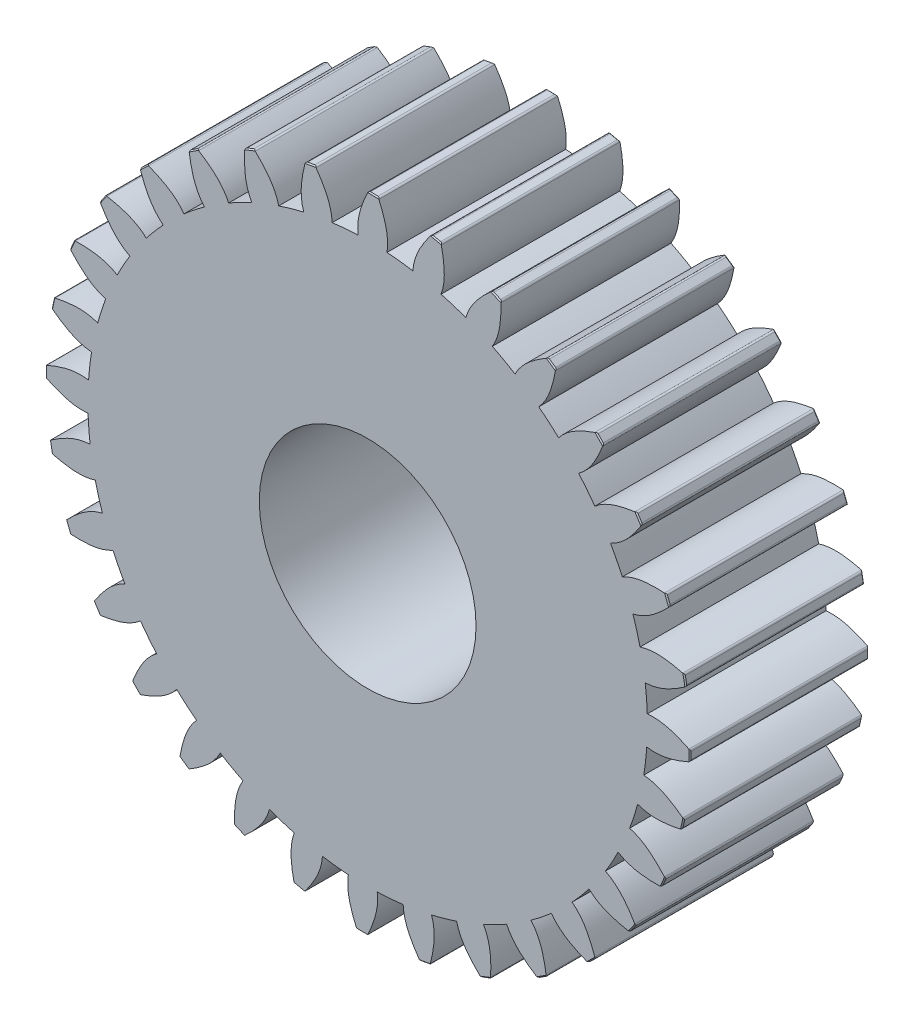
from build123d import *

# Parameters (mm, degrees)
BOSS_EXTRUDE1_DEPTH          = 32.97
CHAMFER1_SIZE                = 0.2
FILLET1_R                    = 0.4
CIRPATTERN1_COUNT            = 32
CHAMFER1_OF_CIRPATTERN1_SIZE = 0.2
FILLET1_OF_CIRPATTERN1_R     = 0.4
SKETCH2_R                    = 20
CUT_EXTRUDE1_DEPTH           = 91.372904183


with BuildPart() as part:
    # Sketch1 → Boss-Extrude1 (new body)
    with BuildSketch(Plane.XY):
        with BuildLine():
            add(Edge.make_bspline(
                [(-12.183256516, 51.965939669), (-12.232441564, 52.341593425), (-12.341968868, 53.847607306), (-12.077216091, 56.010904037), (-11.670723241, 57.750018855), (-11.499653698, 58.378146295)],
                knots=[0, 0, 0, 0, 0.062574462, 0.250076057, 0.35780736, 0.35780736, 0.35780736, 0.35780736], degree=3))
            ThreePointArc((-12.183256516, 51.965939669), (-9.495754582, 52.523530631), (-6.783142181, 52.942228959))
            add(Edge.make_bspline(
                [(-6.783142181, 52.942228959), (-6.868600774, 53.311324803), (-7.293317405, 54.760355453), (-8.298760507, 56.694012855), (-9.288449691, 58.180711245), (-9.668620755, 58.709179629)],
                knots=[0, 0, 0, 0, 0.062574462, 0.250076057, 0.35780736, 0.35780736, 0.35780736, 0.35780736], degree=3))
            ThreePointArc((-9.668620755, 58.709179629), (-10.585431337, 58.550821031), (-11.499653698, 58.378146295))
        make_face()
        with BuildLine():
            ThreePointArc((-6.783142181, 52.942228959), (-9.495754582, 52.523530631), (-12.183256516, 51.965939669))
            add(Edge.make_bspline(
                [(-11.794819767, 50.25955483), (-11.982754877, 50.823685324), (-12.108297794, 51.393437928), (-12.183256516, 51.965939669)],
                knots=[-0.095364383, -0.095364383, -0.095364383, -0.095364383, 0, 0, 0, 0], degree=3))
            ThreePointArc((-11.794819767, 50.25955483), (-9.184418366, 50.801447659), (-6.549522421, 51.207854681))
            add(Edge.make_bspline(
                [(-6.549522421, 51.207854681), (-6.571006643, 51.802077913), (-6.652902053, 52.37972157), (-6.783142181, 52.942228959)],
                knots=[-0.095364383, -0.095364383, -0.095364383, -0.095364383, 0, 0, 0, 0], degree=3))
        make_face()
        with BuildLine():
            ThreePointArc((-6.549522421, 51.207854681), (-9.184418366, 50.801447659), (-11.794819767, 50.25955483))
            ThreePointArc((-11.794819767, 50.25955483), (-32.064256225, -40.460154445), (51.625, 0))
            ThreePointArc((51.625, 0), (34.110273599, 38.750869151), (-6.549522421, 51.207854681))
        make_face()
    boss_extrude1 = extrude(amount=BOSS_EXTRUDE1_DEPTH)

    # Chamfer1
    chamfer1_edges = [part.edges().sort_by_distance(p)[0] for p in [
        (-10.585431337, 58.550821031, 32.97),
        (-10.585431337, 58.550821031, 0),
    ]]
    chamfer(chamfer1_edges, length=CHAMFER1_SIZE)

    # Fillet1
    # the kernel refuses this fillet: 0.4 mm, written as the material it takes off along each edge
    with BuildSketch(Plane(origin=(-11.499653698, 58.378146295, -0.42973065), x_dir=(-0.2582379228489339, -0.9660813501991786, 0), z_dir=(0, 0, 1))) as fillet1_piece_1:
        with BuildLine():
            CenterArc((0.250004627, 0.399995546), FILLET1_R, 205.867749282, 64.402635283)
            ThreePointArc((-0.109916775, 0.225477396), (-0.05507721, 0.112680774), (0, 0))
            ThreePointArc((0, 0), (0.125946129, -0.000296627), (0.25189226, 0))
        make_face()
    extrude(amount=33.8294613, mode=Mode.SUBTRACT)
    with BuildSketch(Plane(origin=(-9.668620755, 58.709179629, -0.42973065), x_dir=(0.5801516251121143, -0.8145084971194424, 0), z_dir=(0, 0, 1))) as fillet1_piece_2:
        with BuildLine():
            CenterArc((0.250004627, -0.399995546), FILLET1_R, 89.729615435, 64.402635283)
            ThreePointArc((-0.109916775, -0.225477396), (-0.05507721, -0.112680774), (0, 0))
            ThreePointArc((0, 0), (0.125946129, 0.000296627), (0.25189226, 0))
        make_face()
    extrude(amount=33.8294613, mode=Mode.SUBTRACT)

    # CirPattern1: Boss-Extrude1 ×32 about axis
    cirpattern1_axis = Axis((0, 0, 0), (0, 0, -1))
    for i in range(1, CIRPATTERN1_COUNT):
        add(boss_extrude1.rotate(cirpattern1_axis, i * 360 / CIRPATTERN1_COUNT))

    # Chamfer1 of CirPattern1
    chamfer1_of_cirpattern1_edges = [part.edges().sort_by_distance(p)[0] for p in [
        (1.040663287, 59.490898631, 32.97),
        (1.040663287, 59.490898631, 0),
        (12.626765805, 58.144774359, 32.97),
        (12.626765805, 58.144774359, 0),
        (23.727628794, 54.564179017, 32.97),
        (23.727628794, 54.564179017, 0),
        (33.916652315, 48.886712875, 32.97),
        (33.916652315, 48.886712875, 0),
        (42.802277908, 41.330557774, 32.97),
        (42.802277908, 41.330557774, 0),
        (50.043035965, 32.186092515, 32.97),
        (50.043035965, 32.186092515, 0),
        (55.360668214, 21.804733772, 32.97),
        (55.360668214, 21.804733772, 0),
        (58.550821031, 10.585431337, 32.97),
        (58.550821031, 10.585431337, 0),
        (59.490898631, -1.040663287, 32.97),
        (59.490898631, -1.040663287, 0),
        (58.144774359, -12.626765805, 32.97),
        (58.144774359, -12.626765805, 0),
        (54.564179017, -23.727628794, 32.97),
        (54.564179017, -23.727628794, 0),
        (48.886712875, -33.916652315, 32.97),
        (48.886712875, -33.916652315, 0),
        (41.330557774, -42.802277908, 32.97),
        (41.330557774, -42.802277908, 0),
        (32.186092515, -50.043035965, 32.97),
        (32.186092515, -50.043035965, 0),
        (21.804733772, -55.360668214, 32.97),
        (21.804733772, -55.360668214, 0),
        (10.585431337, -58.550821031, 32.97),
        (10.585431337, -58.550821031, 0),
        (-1.040663287, -59.490898631, 32.97),
        (-1.040663287, -59.490898631, 0),
        (-12.626765805, -58.144774359, 32.97),
        (-12.626765805, -58.144774359, 0),
        (-23.727628794, -54.564179017, 32.97),
        (-23.727628794, -54.564179017, 0),
        (-33.916652315, -48.886712875, 32.97),
        (-33.916652315, -48.886712875, 0),
        (-42.802277908, -41.330557774, 32.97),
        (-42.802277908, -41.330557774, 0),
        (-50.043035965, -32.186092515, 32.97),
        (-50.043035965, -32.186092515, 0),
        (-55.360668214, -21.804733772, 32.97),
        (-55.360668214, -21.804733772, 0),
        (-58.550821031, -10.585431337, 32.97),
        (-58.550821031, -10.585431337, 0),
        (-59.490898631, 1.040663287, 32.97),
        (-59.490898631, 1.040663287, 0),
        (-58.144774359, 12.626765805, 32.97),
        (-58.144774359, 12.626765805, 0),
        (-54.564179017, 23.727628794, 32.97),
        (-54.564179017, 23.727628794, 0),
        (-48.886712875, 33.916652315, 32.97),
        (-48.886712875, 33.916652315, 0),
        (-41.330557774, 42.802277908, 32.97),
        (-41.330557774, 42.802277908, 0),
        (-32.186092515, 50.043035965, 32.97),
        (-32.186092515, 50.043035965, 0),
        (-21.804733772, 55.360668214, 32.97),
        (-21.804733772, 55.360668214, 0),
    ]]
    chamfer(chamfer1_of_cirpattern1_edges, length=CHAMFER1_OF_CIRPATTERN1_SIZE)

    # Fillet1 of CirPattern1
    # the kernel refuses this fillet: 0.4 mm, written as the material it takes off along each edge
    with BuildSketch(Plane(origin=(0.110320283, 59.499897726, -0.42973065), x_dir=(-0.44174907527628504, -0.8971386484220523, 0), z_dir=(0, 0, 1)), Plane(origin=(11.716054717, 58.335101456, -0.42973065), x_dir=(-0.6082840584765015, -0.7937194115072128, 0), z_dir=(0, 0, 1)), Plane(origin=(22.871547739, 54.928519951, -0.42973065), x_dir=(-0.7514430264390856, -0.6597979827311296, 0), z_dir=(0, 0, 1)), Plane(origin=(33.148100007, 49.411066229, -0.42973065), x_dir=(-0.8657244603096912, -0.5005208874977084, 0), z_dir=(0, 0, 1)), Plane(origin=(42.150789382, 41.994772942, -0.42973065), x_dir=(-0.9467365886745125, -0.3220090552530268, 0), z_dir=(0, 0, 1)), Plane(origin=(49.53364756, 32.964644081, -0.42973065), x_dir=(-0.9913661608725488, -0.1311225955997801, 0), z_dir=(0, 0, 1)), Plane(origin=(55.01295544, 22.667702436, -0.42973065), x_dir=(-0.9978980874728057, 0.06480283186803422, 0), z_dir=(0, 0, 1)), Plane(origin=(58.378146295, 11.499653698, -0.42973065), x_dir=(-0.9660813501991715, 0.2582379228489607, 0), z_dir=(0, 0, 1)), Plane(origin=(59.499897726, -0.110320283, -0.42973065), x_dir=(-0.8971386484220403, 0.4417490752763096, 0), z_dir=(0, 0, 1)), Plane(origin=(58.335101456, -11.716054717, -0.42973065), x_dir=(-0.7937194115072271, 0.6082840584764829, 0), z_dir=(0, 0, 1)), Plane(origin=(54.928519951, -22.871547739, -0.42973065), x_dir=(-0.6597979827311554, 0.7514430264390625, 0), z_dir=(0, 0, 1)), Plane(origin=(49.411066229, -33.148100007, -0.42973065), x_dir=(-0.5005208874977085, 0.8657244603096914, 0), z_dir=(0, 0, 1)), Plane(origin=(41.994772942, -42.150789382, -0.42973065), x_dir=(-0.32200905525300155, 0.9467365886745213, 0), z_dir=(0, 0, 1)), Plane(origin=(32.964644081, -49.53364756, -0.42973065), x_dir=(-0.13112259559975606, 0.991366160872552, 0), z_dir=(0, 0, 1)), Plane(origin=(22.667702436, -55.01295544, -0.42973065), x_dir=(0.06480283186803969, 0.9978980874728053, 0), z_dir=(0, 0, 1)), Plane(origin=(11.499653698, -58.378146295, -0.42973065), x_dir=(0.258237922848941, 0.9660813501991768, 0), z_dir=(0, 0, 1)), Plane(origin=(-0.110320283, -59.499897726, -0.42973065), x_dir=(0.4417490752762871, 0.8971386484220515, 0), z_dir=(0, 0, 1)), Plane(origin=(-11.716054717, -58.335101456, -0.42973065), x_dir=(0.608284058476497, 0.7937194115072161, 0), z_dir=(0, 0, 1)), Plane(origin=(-22.871547739, -54.928519951, -0.42973065), x_dir=(0.7514430264390652, 0.6597979827311524, 0), z_dir=(0, 0, 1)), Plane(origin=(-33.148100007, -49.411066229, -0.42973065), x_dir=(0.865724460309719, 0.5005208874976605, 0), z_dir=(0, 0, 1)), Plane(origin=(-42.150789382, -41.994772942, -0.42973065), x_dir=(0.9467365886745125, 0.3220090552530268, 0), z_dir=(0, 0, 1)), Plane(origin=(-49.53364756, -32.964644081, -0.42973065), x_dir=(0.9913661608725516, 0.13112259559975972, 0), z_dir=(0, 0, 1)), Plane(origin=(-55.01295544, -22.667702436, -0.42973065), x_dir=(0.997898087472806, -0.06480283186803112, 0), z_dir=(0, 0, 1)), Plane(origin=(-58.378146295, -11.499653698, -0.42973065), x_dir=(0.9660813501991786, -0.2582379228489339, 0), z_dir=(0, 0, 1)), Plane(origin=(-59.499897726, 0.110320283, -0.42973065), x_dir=(0.8971386484220517, -0.44174907527628654, 0), z_dir=(0, 0, 1)), Plane(origin=(-58.335101456, 11.716054717, -0.42973065), x_dir=(0.7937194115072088, -0.6082840584765065, 0), z_dir=(0, 0, 1)), Plane(origin=(-54.928519951, 22.871547739, -0.42973065), x_dir=(0.6597979827311575, -0.7514430264390609, 0), z_dir=(0, 0, 1)), Plane(origin=(-49.411066229, 33.148100007, -0.42973065), x_dir=(0.5005208874976662, -0.8657244603097158, 0), z_dir=(0, 0, 1)), Plane(origin=(-41.994772942, 42.150789382, -0.42973065), x_dir=(0.32200905525300155, -0.9467365886745213, 0), z_dir=(0, 0, 1)), Plane(origin=(-32.964644081, 49.53364756, -0.42973065), x_dir=(0.1311225955997707, -0.99136616087255, 0), z_dir=(0, 0, 1)), Plane(origin=(-22.667702436, 55.01295544, -0.42973065), x_dir=(-0.06480283186802564, -0.9978980874728062, 0), z_dir=(0, 0, 1))) as fillet1_of_cirpattern1_piece_1:
        with BuildLine():
            CenterArc((0.250004627, 0.399995546), FILLET1_OF_CIRPATTERN1_R, 205.867749282, 64.402635283)
            ThreePointArc((-0.109916775, 0.225477396), (-0.05507721, 0.112680774), (0, 0))
            ThreePointArc((0, 0), (0.125946129, -0.000296627), (0.25189226, 0))
        make_face()
    extrude(amount=33.8294613, mode=Mode.SUBTRACT)
    with BuildSketch(Plane(origin=(1.97075184, 59.467353541, -0.42973065), x_dir=(0.4101014493240654, -0.9120399120994107, 0), z_dir=(0, 0, 1)), Plane(origin=(13.534389548, 57.940230407, -0.42973065), x_dir=(0.22429130482601403, -0.974522144735277, 0), z_dir=(0, 0, 1)), Plane(origin=(24.577908256, 54.186496711, -0.42973065), x_dir=(0.029861771267534903, -0.9995540378672708, 0), z_dir=(0, 0, 1)), Plane(origin=(34.676911733, 48.350406334, -0.42973065), x_dir=(-0.1657153334140517, -0.9861736298803926, 0), z_dir=(0, 0, 1)), Plane(origin=(43.443300938, 40.656236958, -0.42973065), x_dir=(-0.35492409076684167, -0.9348951223497375, 0), z_dir=(0, 0, 1)), Plane(origin=(50.540188453, 31.399671195, -0.42973065), x_dir=(-0.5304933143550888, -0.847689119562445, 0), z_dir=(0, 0, 1)), Plane(origin=(55.694844868, 20.936433678, -0.42973065), x_dir=(-0.6856759773767959, -0.7279068992998868, 0), z_dir=(0, 0, 1)), Plane(origin=(58.709179629, 9.668620755, -0.42973065), x_dir=(-0.8145084971194424, -0.5801516251121143, 0), z_dir=(0, 0, 1)), Plane(origin=(59.467353541, -1.97075184, -0.42973065), x_dir=(-0.9120399120994138, -0.4101014493240585, 0), z_dir=(0, 0, 1)), Plane(origin=(57.940230407, -13.534389548, -0.42973065), x_dir=(-0.974522144735277, -0.22429130482601403, 0), z_dir=(0, 0, 1)), Plane(origin=(54.186496711, -24.577908256, -0.42973065), x_dir=(-0.9995540378672704, -0.029861771267548153, 0), z_dir=(0, 0, 1)), Plane(origin=(48.350406334, -34.676911733, -0.42973065), x_dir=(-0.9861736298803926, 0.1657153334140517, 0), z_dir=(0, 0, 1)), Plane(origin=(40.656236958, -43.443300938, -0.42973065), x_dir=(-0.9348951223497411, 0.35492409076683235, 0), z_dir=(0, 0, 1)), Plane(origin=(31.399671195, -50.540188453, -0.42973065), x_dir=(-0.8476891195624147, 0.5304933143551369, 0), z_dir=(0, 0, 1)), Plane(origin=(20.936433678, -55.694844868, -0.42973065), x_dir=(-0.7279068992998446, 0.6856759773768407, 0), z_dir=(0, 0, 1)), Plane(origin=(9.668620755, -58.709179629, -0.42973065), x_dir=(-0.5801516251121143, 0.8145084971194424, 0), z_dir=(0, 0, 1)), Plane(origin=(-1.97075184, -59.467353541, -0.42973065), x_dir=(-0.4101014493240553, 0.9120399120994153, 0), z_dir=(0, 0, 1)), Plane(origin=(-13.534389548, -57.940230407, -0.42973065), x_dir=(-0.22429130482602738, 0.9745221447352738, 0), z_dir=(0, 0, 1)), Plane(origin=(-24.577908256, -54.186496711, -0.42973065), x_dir=(-0.029861771267534903, 0.9995540378672708, 0), z_dir=(0, 0, 1)), Plane(origin=(-34.676911733, -48.350406334, -0.42973065), x_dir=(0.1657153334140884, 0.9861736298803866, 0), z_dir=(0, 0, 1)), Plane(origin=(-43.443300938, -40.656236958, -0.42973065), x_dir=(0.35492409076684167, 0.9348951223497375, 0), z_dir=(0, 0, 1)), Plane(origin=(-50.540188453, -31.399671195, -0.42973065), x_dir=(0.5304933143550913, 0.8476891195624432, 0), z_dir=(0, 0, 1)), Plane(origin=(-55.694844868, -20.936433678, -0.42973065), x_dir=(0.685675977376825, 0.7279068992998596, 0), z_dir=(0, 0, 1)), Plane(origin=(-58.709179629, -9.668620755, -0.42973065), x_dir=(0.8145084971194424, 0.5801516251121143, 0), z_dir=(0, 0, 1)), Plane(origin=(-59.467353541, 1.97075184, -0.42973065), x_dir=(0.9120399120994116, 0.410101449324064, 0), z_dir=(0, 0, 1)), Plane(origin=(-57.940230407, 13.534389548, -0.42973065), x_dir=(0.9745221447352768, 0.22429130482601456, 0), z_dir=(0, 0, 1)), Plane(origin=(-54.186496711, 24.577908256, -0.42973065), x_dir=(0.9995540378672704, 0.02986177126755152, 0), z_dir=(0, 0, 1)), Plane(origin=(-48.350406334, 34.676911733, -0.42973065), x_dir=(0.9861736298803895, -0.1657153334140699, 0), z_dir=(0, 0, 1)), Plane(origin=(-40.656236958, 43.443300938, -0.42973065), x_dir=(0.9348951223497375, -0.35492409076684167, 0), z_dir=(0, 0, 1)), Plane(origin=(-31.399671195, 50.540188453, -0.42973065), x_dir=(0.8476891195624187, -0.5304933143551306, 0), z_dir=(0, 0, 1)), Plane(origin=(-20.936433678, 55.694844868, -0.42973065), x_dir=(0.7279068992998529, -0.685675977376832, 0), z_dir=(0, 0, 1))) as fillet1_of_cirpattern1_piece_2:
        with BuildLine():
            CenterArc((0.250004627, -0.399995546), FILLET1_OF_CIRPATTERN1_R, 89.729615435, 64.402635283)
            ThreePointArc((-0.109916775, -0.225477396), (-0.05507721, -0.112680774), (0, 0))
            ThreePointArc((0, 0), (0.125946129, 0.000296627), (0.25189226, 0))
        make_face()
    extrude(amount=33.8294613, mode=Mode.SUBTRACT)

    # Sketch2 → Cut-Extrude1 (cut, through all)
    with BuildSketch(Plane(origin=(0, 0, 0), x_dir=(-1, 0, 0), z_dir=(0, 0, -1))):
        Circle(SKETCH2_R)
    extrude(amount=-CUT_EXTRUDE1_DEPTH, mode=Mode.SUBTRACT)


solid = part.part
